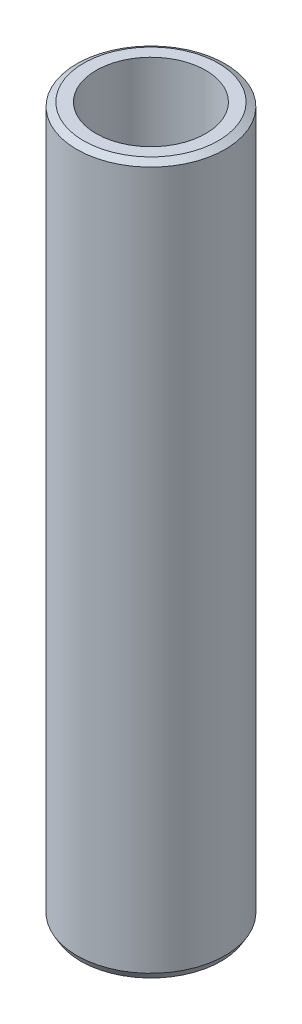
from build123d import *
from OCP.BRepFilletAPI import BRepFilletAPI_MakeChamfer

# Parameters (mm, degrees)
SKETCH1_R           = 50
BOSS_EXTRUDE1_DEPTH = 477.763012247
SKETCH2_R           = 36.939897975
CUT_EXTRUDE1_DEPTH  = 483.967385929
CHAMFER1_SIZE       = 2.684592477
CHAMFER1_SIZE2      = 4.649850567


with BuildPart() as part:
    # Sketch1 → Boss-Extrude1 (new body)
    with BuildSketch(Plane(origin=(0, 0, 0), x_dir=(1, 0, 0), z_dir=(0, 1, 0))):
        Circle(SKETCH1_R)
    extrude(amount=BOSS_EXTRUDE1_DEPTH)

    # Sketch2 → Cut-Extrude1 (cut, through all)
    with BuildSketch(Plane(origin=(0, 0, 0), x_dir=(1, 0, 0), z_dir=(0, 1, 0))):
        Circle(SKETCH2_R)
    extrude(amount=CUT_EXTRUDE1_DEPTH, mode=Mode.SUBTRACT)

    # Chamfer1: one chamfer whose edges measure the first distance from different faces: ONE call of the kernel's chamfer builder (chamfer() names one face for all edges)
    chamfer1_edges_1 = [part.edges().sort_by_distance(p)[0] for p in [
        (-50, 477.763012247, 0),
    ]]
    chamfer1_side_1 = [part.faces().sort_by_distance(p)[0] for p in [
        (-50, 238.881506123, 0),
    ]]
    chamfer1_edges_2 = [part.edges().sort_by_distance(p)[0] for p in [
        (-50, 0, 0),
    ]]
    chamfer1_side_2 = [part.faces().sort_by_distance(p)[0] for p in [
        (-48.585786438, 0, 0),
    ]]
    chamfer1 = BRepFilletAPI_MakeChamfer(part.part.solid().wrapped)
    for e in chamfer1_edges_1:
        chamfer1.Add(CHAMFER1_SIZE, CHAMFER1_SIZE2, e.wrapped, chamfer1_side_1[0].wrapped)  # the first distance lies on this face
    for e in chamfer1_edges_2:
        chamfer1.Add(CHAMFER1_SIZE, CHAMFER1_SIZE2, e.wrapped, chamfer1_side_2[0].wrapped)  # the first distance lies on this face
    add(Compound.cast(chamfer1.Shape()), mode=Mode.REPLACE)


solid = part.part
